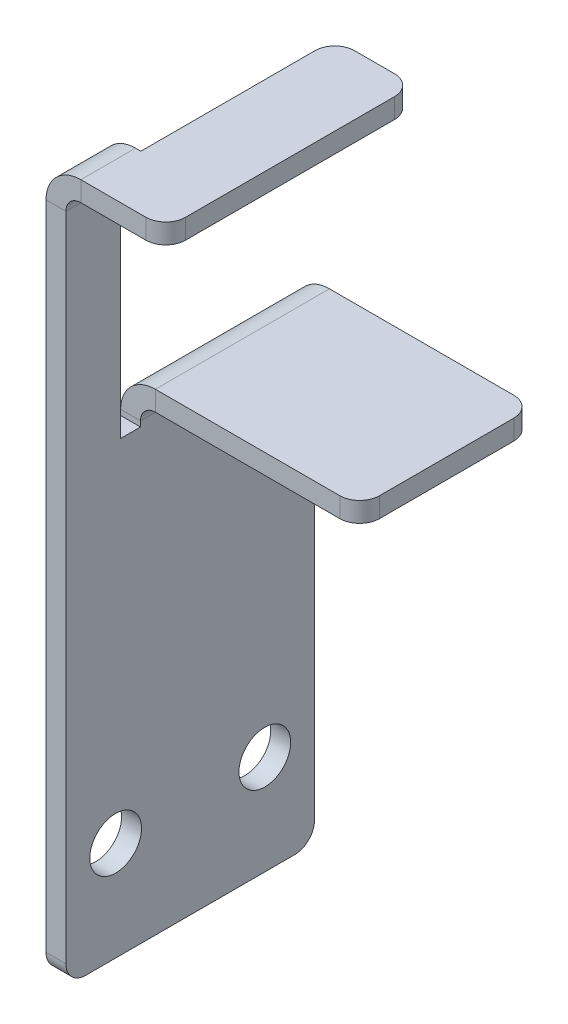
from build123d import *

# Parameters (mm, degrees)
SKETCH1_W                  = 31.75
SKETCH1_H                  = 101.6
BASE_FLANGE1_DEPTH         = 2.54
CUT_EXTRUDE1_DEPTH         = 107.475697227
FILLET1_R                  = 2.54
FILLET2_R                  = 2.54
SKETCH7_R                  = 3.302
CUT_EXTRUDE2_DEPTH         = 2.54
SKETCHED_START             = 61.806879931
SKETCHED_BEND7_OUTLINE_W   = 2.54
SKETCHED_BEND7_OUTLINE_H   = 22.225
SKETCHED_BEND7_DEPTH       = 27.093120069
SKETCHED_START_2           = 59.736360831
SKETCHED_BEND7_2_DEPTH     = 2.0705191
SKETCHED_START_3           = 57.831360831
SKETCHED_BEND7_3_DEPTH     = 4.445
SKETCHED_START_4           = -33
SKETCHED_BEND7_4_DEPTH     = 23.475
SKETCHED_START_5           = -31.75
SKETCHED_BEND7_5_DEPTH     = 22.225
SKETCHED_START_6           = 90.216360831
SKETCHED_BEND8_OUTLINE_W   = 2.54
SKETCHED_BEND8_OUTLINE_H   = 31.75
SKETCHED_BEND8_DEPTH       = 11.383639169
SKETCHED_START_7           = 87.676360831
SKETCHED_BEND8_2_DEPTH     = 2.0705191
SKETCHED_START_8           = 89.948086031
SKETCHED_BEND8_3_OUTLINE_W = 2.54
SKETCHED_BEND8_3_OUTLINE_H = 6.985
SKETCHED_BEND8_3_DEPTH     = 0.2682748
SKETCHED_START_9           = 85.771360831
SKETCHED_BEND8_4_DEPTH     = 4.445
SKETCHED_BEND8_5_DEPTH     = 31.75


with BuildPart() as part:
    # Base-Flange1: sheet metal written as solids
    # Sketch1 → Base-Flange1 (new body)
    with BuildSketch(Plane(origin=(0, 0, 0), x_dir=(0, 0, -1), z_dir=(1, 0, 0))):
        with Locations((15.875, 50.8)):
            Rectangle(SKETCH1_W, SKETCH1_H)
    extrude(amount=-BASE_FLANGE1_DEPTH)

    # Sketch6 → Cut-Extrude1 (cut, through all)
    with BuildSketch(Plane(origin=(0, 0, 0), x_dir=(0, 0, -1), z_dir=(1, 0, 0))):
        with BuildLine():
            Line((31.75, 88.9), (12.065, 88.9))
            ThreePointArc((12.065, 88.9), (10.268948776, 88.156051224), (9.525, 86.36))
            Line((9.525, 86.36), (9.525, 57.15))
            Line((9.525, 57.15), (6.985, 57.15))
            Line((6.985, 57.15), (6.985, 91.44))
            Line((6.985, 91.44), (31.75, 91.44))
            Line((31.75, 91.44), (31.75, 88.9))
        make_face()
    extrude(amount=-CUT_EXTRUDE1_DEPTH, mode=Mode.SUBTRACT)

    # Fillet1
    fillet1_edges = [part.edges().sort_by_distance(p)[0] for p in [
        (-1.27, 88.9, -31.75),
    ]]
    fillet(fillet1_edges, radius=FILLET1_R)

    # Fillet2
    fillet2_edges = [part.edges().sort_by_distance(p)[0] for p in [
        (-1.27, 91.44, -31.75),
        (-1.27, 101.6, 0),
        (-1.27, 101.6, -31.75),
        (-1.27, 0, -31.75),
        (-1.27, 0, 0),
    ]]
    fillet(fillet2_edges, radius=FILLET2_R)

    # Sketch7 → Cut-Extrude2 (cut)
    with BuildSketch(Plane(origin=(0, 0, 0), x_dir=(0, 0, -1), z_dir=(1, 0, 0))):
        with Locations((6.35, 12.7)):
            Circle(SKETCH7_R)
        with Locations((25.4, 12.7)):
            Circle(SKETCH7_R)
    extrude(amount=-CUT_EXTRUDE2_DEPTH, mode=Mode.SUBTRACT)

    # Sketched Bend7: read off the stored shape, not the designer's step
    # Sketched Bend7 outline → Sketched Bend7 (cut)
    with BuildSketch(Plane(origin=(0, 0, 0), x_dir=(1, 0, 0), z_dir=(0, 1, 0)).offset(SKETCHED_START)):
        with Locations((-1.27, 20.6375)):
            Rectangle(SKETCHED_BEND7_OUTLINE_W, SKETCHED_BEND7_OUTLINE_H)
    extrude(amount=SKETCHED_BEND7_DEPTH, mode=Mode.SUBTRACT)

    # Sketched Bend7 2 outline → Sketched Bend7 2 (add)
    with BuildSketch(Plane(origin=(0, 0, 0), x_dir=(1, 0, 0), z_dir=(0, 1, 0)).offset(SKETCHED_START_2)):
        with BuildLine():
            Line((0, 9.525), (25.446360831, 9.525))
            ThreePointArc((25.446360831, 9.525), (27.242412055, 10.268948776), (27.986360831, 12.065))
            Line((27.986360831, 12.065), (27.986360831, 29.21))
            ThreePointArc((27.986360831, 29.21), (27.242412055, 31.006051224), (25.446360831, 31.75))
            Line((25.446360831, 31.75), (0, 31.75))
            Line((0, 31.75), (0, 9.525))
        make_face()
    extrude(amount=SKETCHED_BEND7_2_DEPTH)

    # Sketched Bend7 3 outline → Sketched Bend7 3 (add)
    with BuildSketch(Plane(origin=(0, 0, 0), x_dir=(1, 0, 0), z_dir=(0, 1, 0)).offset(SKETCHED_START_3)):
        with BuildLine():
            Line((0, 9.525), (25.446360831, 9.525))
            ThreePointArc((25.446360831, 9.525), (27.242412055, 10.268948776), (27.986360831, 12.065))
            Line((27.986360831, 12.065), (27.986360831, 29.21))
            ThreePointArc((27.986360831, 29.21), (27.242412055, 31.006051224), (25.446360831, 31.75))
            Line((25.446360831, 31.75), (0, 31.75))
            Line((0, 31.75), (0, 9.525))
        make_face()
    extrude(amount=SKETCHED_BEND7_3_DEPTH)

    # Sketched Bend7 4 outline → Sketched Bend7 4 (cut)
    with BuildSketch(Plane.XY.offset(SKETCHED_START_4)):
        with BuildLine():
            Line((27.986360831, 57.831360831), (27.986360831, 59.736360831))
            Line((27.986360831, 59.736360831), (1.905, 59.736360831))
            ThreePointArc((1.905, 59.736360831), (0.557961582, 59.178399249), (0, 57.831360831))
            Line((0, 57.831360831), (27.986360831, 57.831360831))
        make_face()
        with BuildLine():
            ThreePointArc((-2.54, 57.831360831), (-1.876266121, 60.168036145), (-0.083283905, 61.806879931))
            Line((-0.083283905, 61.806879931), (-2.54, 61.806879931))
            Line((-2.54, 61.806879931), (-2.54, 57.831360831))
        make_face()
        with BuildLine():
            ThreePointArc((0, 61.84745346), (0.928656498, 62.167808498), (1.905, 62.276360831))
            Line((1.905, 62.276360831), (0, 62.276360831))
            Line((0, 62.276360831), (0, 61.84745346))
        make_face()
    extrude(amount=SKETCHED_BEND7_4_DEPTH, mode=Mode.SUBTRACT)

    # Sketched Bend7 5 outline → Sketched Bend7 5 (add)
    with BuildSketch(Plane.XY.offset(SKETCHED_START_5)):
        with BuildLine():
            Line((0, 61.806879931), (0, 61.84745346))
            ThreePointArc((0, 61.84745346), (-0.041747658, 61.827383673), (-0.083283905, 61.806879931))
            Line((-0.083283905, 61.806879931), (0, 61.806879931))
        make_face()
    extrude(amount=SKETCHED_BEND7_5_DEPTH)

    # Sketched Bend8: read off the stored shape, not the designer's step
    # Sketched Bend8 outline → Sketched Bend8 (cut)
    with BuildSketch(Plane(origin=(0, 0, 0), x_dir=(1, 0, 0), z_dir=(0, 1, 0)).offset(SKETCHED_START_6)):
        with Locations((-1.27, 15.875)):
            Rectangle(SKETCHED_BEND8_OUTLINE_W, SKETCHED_BEND8_OUTLINE_H)
    extrude(amount=SKETCHED_BEND8_DEPTH, mode=Mode.SUBTRACT)

    # Sketched Bend8 2 outline → Sketched Bend8 2 (add)
    with BuildSketch(Plane(origin=(0, 0, 0), x_dir=(1, 0, 0), z_dir=(0, 1, 0)).offset(SKETCHED_START_7)):
        with BuildLine():
            Line((0, 6.985), (0, 0))
            Line((0, 0), (10.206360831, 0))
            ThreePointArc((10.206360831, 0), (12.002412055, 0.743948776), (12.746360831, 2.54))
            Line((12.746360831, 2.54), (12.746360831, 29.21))
            ThreePointArc((12.746360831, 29.21), (12.002412055, 31.006051224), (10.206360831, 31.75))
            Line((10.206360831, 31.75), (5.126360831, 31.75))
            ThreePointArc((5.126360831, 31.75), (3.330309607, 31.006051224), (2.586360831, 29.21))
            Line((2.586360831, 29.21), (2.586360831, 6.985))
            Line((2.586360831, 6.985), (0, 6.985))
        make_face()
    extrude(amount=SKETCHED_BEND8_2_DEPTH)

    # Sketched Bend8 3 outline → Sketched Bend8 3 (cut)
    with BuildSketch(Plane(origin=(0, 0, 0), x_dir=(1, 0, 0), z_dir=(0, 1, 0)).offset(SKETCHED_START_8)):
        with Locations((-1.27, 3.4925)):
            Rectangle(SKETCHED_BEND8_3_OUTLINE_W, SKETCHED_BEND8_3_OUTLINE_H)
    extrude(amount=SKETCHED_BEND8_3_DEPTH, mode=Mode.SUBTRACT)

    # Sketched Bend8 4 outline → Sketched Bend8 4 (add)
    with BuildSketch(Plane(origin=(0, 0, 0), x_dir=(1, 0, 0), z_dir=(0, 1, 0)).offset(SKETCHED_START_9)):
        with BuildLine():
            Line((0, 0), (10.206360831, 0))
            ThreePointArc((10.206360831, 0), (12.002412055, 0.743948776), (12.746360831, 2.54))
            Line((12.746360831, 2.54), (12.746360831, 29.21))
            ThreePointArc((12.746360831, 29.21), (12.002412055, 31.006051224), (10.206360831, 31.75))
            Line((10.206360831, 31.75), (5.126360831, 31.75))
            ThreePointArc((5.126360831, 31.75), (3.330309607, 31.006051224), (2.586360831, 29.21))
            Line((2.586360831, 29.21), (2.586360831, 6.985))
            Line((2.586360831, 6.985), (0, 6.985))
            Line((0, 6.985), (0, 0))
        make_face()
    extrude(amount=SKETCHED_BEND8_4_DEPTH)

    # Sketched Bend8 5 outline → Sketched Bend8 5 (cut)
    with BuildSketch(Plane.XY.offset(SKETCHED_START_5)):
        with BuildLine():
            Line((-2.54, 89.948086031), (-2.54, 85.771360831))
            ThreePointArc((-2.54, 85.771360831), (-1.238089643, 88.914450473), (1.905, 90.216360831))
            Line((1.905, 90.216360831), (0, 90.216360831))
            Line((0, 90.216360831), (0, 89.948086031))
            Line((0, 89.948086031), (-2.54, 89.948086031))
        make_face()
        with BuildLine():
            Line((0, 85.771360831), (12.746360831, 85.771360831))
            Line((12.746360831, 85.771360831), (12.746360831, 87.676360831))
            Line((12.746360831, 87.676360831), (1.905, 87.676360831))
            ThreePointArc((1.905, 87.676360831), (0.557961582, 87.118399249), (0, 85.771360831))
        make_face()
    extrude(amount=SKETCHED_BEND8_5_DEPTH, mode=Mode.SUBTRACT)


solid = part.part
